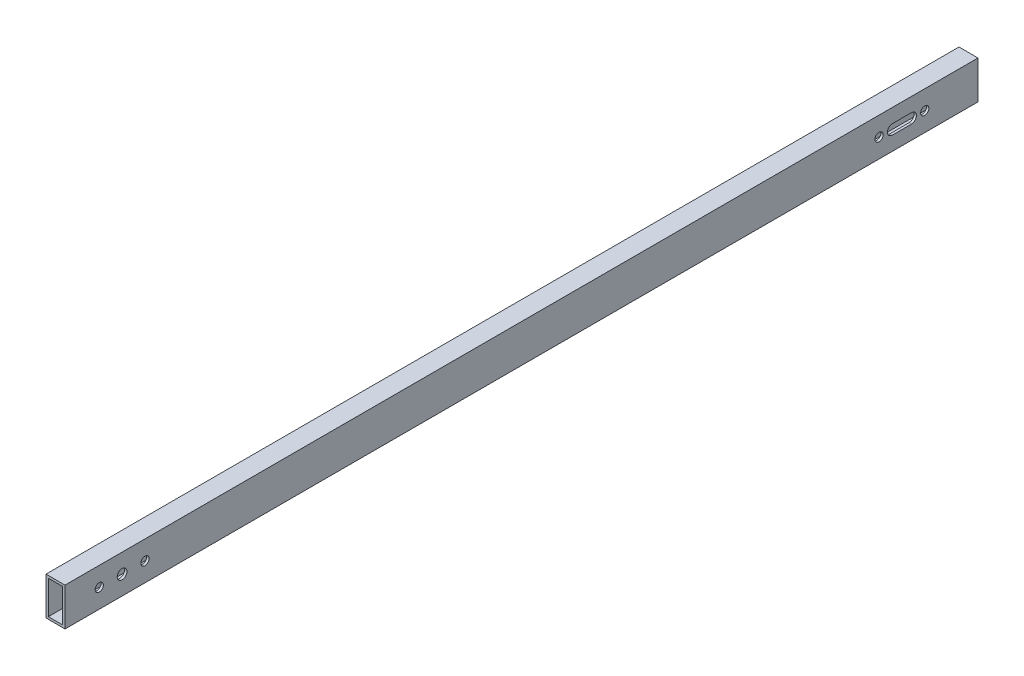
from build123d import *

# Parameters (mm, degrees)
SKETCH1_W           = 12.7
SKETCH1_H           = 25.4
SKETCH1_W_2         = 9.525
SKETCH1_H_2         = 22.225
BOSS_EXTRUDE1_DEPTH = 609.6
SKETCH2_R           = 3.25
SKETCH2_R_2         = 2.75
CUT_EXTRUDE1_DEPTH  = 610.86452594
CUT_EXTRUDE3_REACH  = 611.865
CUT_EXTRUDE5_REACH  = 612.162
SKETCH5_R           = 2.75


with BuildPart() as part:
    # Sketch1 → Boss-Extrude1 (new body)
    with BuildSketch(Plane.XY):
        Rectangle(SKETCH1_W, SKETCH1_H)
        Rectangle(SKETCH1_W_2, SKETCH1_H_2, mode=Mode.SUBTRACT)
    extrude(amount=BOSS_EXTRUDE1_DEPTH)

    # Sketch2 → Cut-Extrude1 (cut, through all)
    with BuildSketch(Plane(origin=(6.35, 0, 0), x_dir=(0, 0, -1), z_dir=(1, 0, 0))):
        with Locations((-571.5, 0)):
            Circle(SKETCH2_R)
        with Locations((-586.74, 0)):
            Circle(SKETCH2_R_2)
        with Locations((-556.26, 0)):
            Circle(SKETCH2_R_2)
        with Locations((-66.04, 0)):
            Circle(SKETCH2_R_2)
        with Locations((-35.56, 0)):
            Circle(SKETCH2_R_2)
        with BuildLine():
            Line((-44.45, -3.302), (-57.15, -3.302))
            ThreePointArc((-57.15, -3.302), (-60.452, 0), (-57.15, 3.302))
            Line((-57.15, 3.302), (-44.45, 3.302))
            ThreePointArc((-44.45, 3.302), (-41.148, 0), (-44.45, -3.302))
        make_face()
    extrude(amount=-CUT_EXTRUDE1_DEPTH, mode=Mode.SUBTRACT)

    # Sketch4 → Cut-Extrude3 (cut, up to next)
    with BuildSketch(Plane.ZY.offset(6.35), mode=Mode.PRIVATE) as cut_extrude3_sk1:
        with BuildLine():
            Line((35.56, 5), (66.04, 5))
            ThreePointArc((66.04, 5), (71.04, 0), (66.04, -5))
            Line((66.04, -5), (35.56, -5))
            ThreePointArc((35.56, -5), (30.56, 0), (35.56, 5))
        make_face()
    cut_extrude3_tool1 = extrude(cut_extrude3_sk1.sketch, amount=-CUT_EXTRUDE3_REACH, mode=Mode.PRIVATE) & part.part
    # Sketch4 → Cut-Extrude3 (cut, up to next)
    with BuildSketch(Plane.ZY.offset(6.35), mode=Mode.PRIVATE) as cut_extrude3_sk2:
        with BuildLine():
            Line((556.26, 5), (586.74, 5))
            ThreePointArc((586.74, 5), (591.74, 0), (586.74, -5))
            Line((586.74, -5), (556.26, -5))
            ThreePointArc((556.26, -5), (551.26, 0), (556.26, 5))
        make_face()
    cut_extrude3_tool2 = extrude(cut_extrude3_sk2.sketch, amount=-CUT_EXTRUDE3_REACH, mode=Mode.PRIVATE) & part.part
    add(cut_extrude3_tool1.solids().sort_by_distance((-6.35, 0, 50.8))[0], mode=Mode.SUBTRACT)
    add(cut_extrude3_tool2.solids().sort_by_distance((-6.35, 0, 571.5))[0], mode=Mode.SUBTRACT)

    # Sketch5 → Cut-Extrude5 (cut, up to next)
    with BuildSketch(Plane.XZ.offset(12.7), mode=Mode.PRIVATE) as cut_extrude5_sk1:
        with Locations((0, 596.9)):
            Circle(SKETCH5_R)
    cut_extrude5_tool1 = extrude(cut_extrude5_sk1.sketch, amount=-CUT_EXTRUDE5_REACH, mode=Mode.PRIVATE) & part.part
    # Sketch5 → Cut-Extrude5 (cut, up to next)
    with BuildSketch(Plane.XZ.offset(12.7), mode=Mode.PRIVATE) as cut_extrude5_sk2:
        with Locations((0, 12.7)):
            Circle(SKETCH5_R)
    cut_extrude5_tool2 = extrude(cut_extrude5_sk2.sketch, amount=-CUT_EXTRUDE5_REACH, mode=Mode.PRIVATE) & part.part
    add(cut_extrude5_tool1.solids().sort_by_distance((0, -12.7, 596.9))[0], mode=Mode.SUBTRACT)
    add(cut_extrude5_tool2.solids().sort_by_distance((0, -12.7, 12.7))[0], mode=Mode.SUBTRACT)


solid = part.part
